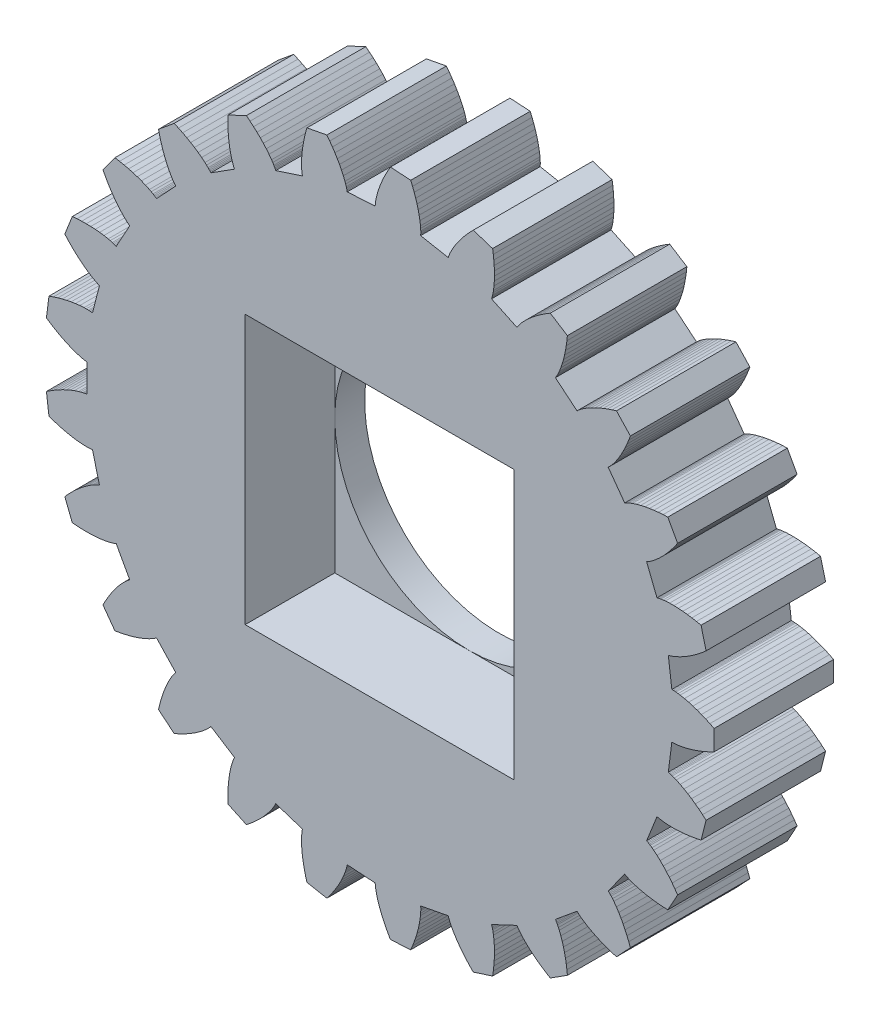
from build123d import *

# Parameters (mm, degrees)
MODEL_R             = 4.5
BOSS_EXTRUDE1_DEPTH = 4
SKETCH1_W           = 9
SKETCH1_H           = 9
CUT_EXTRUDE1_DEPTH  = 3


with BuildPart() as part:
    # Model → Boss-Extrude1 (new body)
    with BuildSketch(Plane.XY):
        Polygon((22.5153116, 13.49371), (22.5501244, 13.4944492), (22.5850516, 13.4935692), (22.6200756, 13.4916244), (22.6551524, 13.4887996), (22.7254732, 13.4809588), (22.7959612, 13.4705748), (22.9373156, 13.4433212), (23.0790396, 13.4084996), (23.2209836, 13.3669196), (23.3630332, 13.319118), (23.5050916, 13.2654556), (23.6470444, 13.2062052), (23.7888124, 13.1415956), (23.93029, 13.071794), (23.93029, 12.391466), (23.7888124, 12.3216644), (23.6470444, 12.257046), (23.5050916, 12.1978044), (23.3630332, 12.144142), (23.2209836, 12.0963316), (23.0790396, 12.0547516), (22.9373156, 12.01993), (22.7959612, 11.9926764), (22.7254732, 11.9822924), (22.6551524, 11.9744516), (22.6200756, 11.9716356), (22.5850516, 11.969682), (22.5501244, 11.9688108), (22.5153116, 11.96955), (22.397462, 11.036662), (22.4313596, 11.0287244), (22.4649756, 11.0191852), (22.4984068, 11.00859), (22.5316884, 10.9971324), (22.5978468, 10.9720524), (22.6635388, 10.9444644), (22.7936732, 10.8829084), (22.9222852, 10.8139428), (23.0494276, 10.7383684), (23.1751356, 10.6567396), (23.299374, 10.569426), (23.4221428, 10.4767444), (23.5433804, 10.378906), (23.6630604, 10.2761132), (23.4938716, 9.6171516), (23.3394756, 9.5847324), (23.1860916, 9.5574084), (23.0338604, 9.5353204), (22.8829228, 9.5186708), (22.733446, 9.5076972), (22.5856236, 9.5027252), (22.4396932, 9.5042388), (22.295998, 9.5129948), (22.2251404, 9.5204748), (22.1550836, 9.5303572), (22.1204028, 9.53635), (22.0860036, 9.5431788), (22.0519476, 9.5510108), (22.0184196, 9.5603828), (21.6722716, 8.6861204), (21.7031332, 8.6699988), (21.7333172, 8.6523988), (21.76307, 8.633822), (21.7924532, 8.6144532), (21.8502868, 8.5737004), (21.9070556, 8.530642), (22.0178036, 8.4386644), (22.1252164, 8.3398756), (22.2295756, 8.2350588), (22.331022, 8.1247332), (22.4296524, 8.0092684), (22.5255108, 7.8889636), (22.6186148, 7.7640476), (22.7089732, 7.634714), (22.3812172, 7.0385404), (22.2236092, 7.0455364), (22.068254, 7.0572052), (21.91531, 7.0736788), (21.7649708, 7.0950892), (21.6174652, 7.12163), (21.4730484, 7.153574), (21.3320812, 7.1913348), (21.195074, 7.2355548), (21.1283084, 7.2604148), (21.0629068, 7.2874132), (21.0308044, 7.3018452), (20.999186, 7.3170076), (20.9681484, 7.3330676), (20.9379996, 7.3504828), (20.3853068, 6.5897668), (20.4111876, 6.566482), (20.4360564, 6.5419212), (20.4602476, 6.5165332), (20.4838844, 6.4904676), (20.5297764, 6.4366116), (20.5740492, 6.3807932), (20.6584412, 6.264158), (20.737914, 6.1417588), (20.8129252, 6.014282), (20.8837564, 5.882194), (20.950566, 5.7458292), (21.0134948, 5.6054604), (21.0726132, 5.4613164), (21.1279652, 5.313582), (20.6622428, 4.8176404), (20.5113228, 4.8636116), (20.3637556, 4.9135604), (20.2197172, 4.9675484), (20.0794276, 5.0256724), (19.9431508, 5.0880556), (19.8112124, 5.154918), (19.6840612, 5.22655), (19.562366, 5.3034532), (19.5038724, 5.3441356), (19.4472444, 5.3865516), (19.4197444, 5.4085076), (19.392878, 5.431062), (19.3668124, 5.454338), (19.3419436, 5.4787052), (18.6174308, 4.8793372), (18.6367116, 4.8503412), (18.65469, 4.8203684), (18.671806, 4.789762), (18.6882268, 4.7586364), (18.7192732, 4.6950564), (18.748278, 4.6299804), (18.8010076, 4.4960268), (18.8475508, 4.3577084), (18.888506, 4.2155796), (18.9242516, 4.0700276), (18.9550604, 3.921334), (18.9810996, 3.7697276), (19.00251, 3.6154108), (19.0193796, 3.4585508), (18.4449596, 3.0940108), (18.310214, 3.1760708), (18.1797012, 3.2611404), (18.0536148, 3.3492548), (17.9321836, 3.4404404), (17.8157068, 3.5347676), (17.7045452, 3.6323332), (17.5992092, 3.7333396), (17.5004468, 3.838086), (17.4539124, 3.8920388), (17.4096132, 3.947206), (17.3884316, 3.9753132), (17.3680332, 4.003834), (17.3485676, 4.0328564), (17.3305364, 4.0626444), (16.4797348, 3.6622884), (16.4911924, 3.6294116), (16.501154, 3.59591), (16.5101212, 3.5620124), (16.5182788, 3.5277716), (16.5325524, 3.4584716), (16.5444588, 3.38823), (16.5622172, 3.2453708), (16.5729004, 3.0998188), (16.5772212, 2.9519788), (16.575646, 2.802106), (16.5685092, 2.6504204), (16.5560308, 2.497098), (16.5383868, 2.342306), (16.515718, 2.1861764), (15.8686892, 1.9759444), (15.7585836, 2.0889364), (15.6533268, 2.203794), (15.5531124, 2.3204996), (15.458178, 2.439018), (15.368814, 2.5593404), (15.2854076, 2.6814932), (15.2084956, 2.8055204), (15.1388964, 2.9315364), (15.107234, 2.9953628), (15.0780444, 3.059814), (15.0645276, 3.0923036), (15.0518556, 3.1250044), (15.040222, 3.1579604), (15.0301724, 3.1912948), (14.1065244, 3.0151012), (14.1094548, 2.9804116), (14.110766, 2.9454844), (14.1110212, 2.9104164), (14.110414, 2.8752252), (14.1069996, 2.8045612), (14.1010596, 2.733554), (14.082738, 2.5907652), (14.0568836, 2.4471404), (14.024306, 2.3028644), (13.9855068, 2.1580868), (13.9408732, 2.0129484), (13.8906516, 1.867546), (13.8350708, 1.7220028), (13.7742892, 1.5764156), (13.0953076, 1.5337004), (13.0167588, 1.6705228), (12.9433668, 1.8079524), (12.8753252, 1.94591), (12.8128452, 2.0843076), (12.7562172, 2.2230836), (12.7058108, 2.3621324), (12.662154, 2.5013924), (12.6260828, 2.640758), (12.61129, 2.710454), (12.5990492, 2.7801412), (12.5940332, 2.8149716), (12.5898884, 2.849802), (12.5868172, 2.8846148), (12.585374, 2.9194012), (11.6469332, 2.9784404), (11.641134, 2.9441116), (11.6337244, 2.9099588), (11.62525, 2.8759292), (11.6159044, 2.8419964), (11.5950308, 2.7743948), (11.5716228, 2.7071012), (11.5183564, 2.57335), (11.4576012, 2.4406636), (11.390158, 2.3090244), (11.3165812, 2.17845), (11.2372492, 2.0489668), (11.1524524, 1.9206276), (11.0624196, 1.7934764), (10.9673444, 1.6675836), (10.2990636, 1.7950604), (10.2570084, 1.9471156), (10.22011, 2.0984756), (10.188518, 2.249026), (10.1624172, 2.3986172), (10.1420716, 2.5471084), (10.1278332, 2.6943324), (10.120186, 2.8400692), (10.1199044, 2.9840284), (10.122914, 3.0552116), (10.1283788, 3.1257524), (10.1321804, 3.1607412), (10.1368356, 3.1955012), (10.1425204, 3.2299884), (10.1497628, 3.2640444), (9.2554892, 3.5546116), (9.2413388, 3.5227996), (9.225666, 3.4915596), (9.2089988, 3.4607068), (9.1915132, 3.430162), (9.154474, 3.369882), (9.1150676, 3.3105172), (9.030218, 3.1942252), (8.9383724, 3.0808108), (8.840314, 2.9700804), (8.7365708, 2.861902), (8.62753, 2.756214), (8.513482, 2.6529988), (8.3946556, 2.55223), (8.2712532, 2.453934), (7.6556756, 2.7436036), (7.6527628, 2.9013436), (7.6546548, 3.05713), (7.6614924, 3.2108044), (7.6734164, 3.362182), (7.6906468, 3.5110692), (7.7134652, 3.6572108), (7.742294, 3.8002724), (7.7778196, 3.9397788), (7.798438, 4.0079788), (7.8212828, 4.0749468), (7.8336732, 4.1078852), (7.8468204, 4.1404012), (7.8608916, 4.1723804), (7.8763884, 4.2035676), (7.08247, 4.7074028), (7.0608484, 4.6801052), (7.0379068, 4.6537492), (7.0140852, 4.6280092), (6.9895508, 4.6027796), (6.938678, 4.5535964), (6.8857548, 4.5059004), (6.774646, 4.4143628), (6.6574828, 4.3273572), (6.5349692, 4.2444876), (6.4075804, 4.1655076), (6.275686, 4.0902588), (6.13955, 4.0186444), (5.9994012, 3.9506028), (5.8554332, 3.8860812), (5.331226, 4.3197364), (5.3676316, 4.4732436), (5.4082084, 4.623662), (5.4530444, 4.7708068), (5.5022452, 4.9144668), (5.5559604, 5.0543956), (5.6144012, 5.1902676), (5.6779108, 5.3216604), (5.7470084, 5.4479492), (5.783942, 5.5088804), (5.8227236, 5.5680604), (5.8429108, 5.5968892), (5.8637316, 5.6251108), (5.885318, 5.6525932), (5.9080836, 5.6789404), (5.2643988, 6.36439), (5.2366788, 6.3433316), (5.207894, 6.3235052), (5.1784228, 6.3044972), (5.1483884, 6.286158), (5.0868852, 6.2511692), (5.023754, 6.2181428), (4.8933732, 6.157106), (4.758258, 6.101974), (4.6189804, 6.0521748), (4.475954, 6.0073564), (4.3294868, 5.9672724), (4.1798164, 5.9317644), (4.027154, 5.9007092), (3.871658, 5.8740188), (3.4717684, 6.4244148), (3.5452044, 6.5640532), (3.6219228, 6.6996436), (3.7019412, 6.8310188), (3.7853212, 6.9579324), (3.872142, 7.0801028), (3.9625444, 7.197178), (4.0567308, 7.3086476), (4.1550708, 7.4137812), (4.2059964, 7.4636156), (4.2582684, 7.511294), (4.284994, 7.5341916), (4.3121772, 7.55635), (4.3399236, 7.577602), (4.3685236, 7.5974636), (3.9155348, 8.4214516), (3.8834412, 8.4079436), (3.8506348, 8.3959052), (3.817362, 8.384826), (3.783702, 8.37453), (3.7154316, 8.3559356), (3.6460788, 8.3396468), (3.50461, 8.3129476), (3.360026, 8.2931564), (3.2127404, 8.2795516), (3.0630612, 8.2717108), (2.9112348, 8.2693172), (2.7574372, 8.272142), (2.6018356, 8.2800268), (2.4445972, 8.2928484), (2.1941492, 8.9254012), (2.2999956, 9.0423884), (2.4080244, 9.15465), (2.5182004, 9.2619924), (2.6305236, 9.364178), (2.7450028, 9.4609252), (2.8616732, 9.5518292), (2.9806316, 9.6363796), (3.1020276, 9.713758), (3.163742, 9.7493628), (3.2262308, 9.7825388), (3.257814, 9.7980708), (3.2896524, 9.8127756), (3.3218076, 9.8264508), (3.3544468, 9.8385772), (3.1206044, 10.7493332), (3.0861612, 10.744238), (3.0513924, 10.7407356), (3.0164124, 10.7382716), (2.9812564, 10.7366788), (2.9105044, 10.7356404), (2.8392772, 10.73711), (2.6956172, 10.7464292), (2.550646, 10.7632196), (2.40461, 10.7866804), (2.2576852, 10.8163012), (2.1100212, 10.8517388), (1.9617588, 10.8927292), (1.8130124, 10.9390612), (1.6638964, 10.9905764), (1.5786332, 11.6655452), (1.7102548, 11.7525332), (1.8428004, 11.8343996), (1.9762172, 11.9109684), (2.1104172, 11.9820196), (2.2453652, 12.0472452), (2.3809732, 12.1062932), (2.5172148, 12.1586004), (2.654046, 12.2033572), (2.7226772, 12.2224884), (2.791458, 12.2390852), (2.8259012, 12.2462748), (2.8603972, 12.252602), (2.894946, 12.2578468), (2.9295828, 12.2614812), (2.9295828, 13.2017788), (2.894946, 13.2054044), (2.8603972, 13.210658), (2.8259012, 13.2169764), (2.791458, 13.224166), (2.7226772, 13.2407628), (2.654046, 13.2599028), (2.5172148, 13.3046596), (2.3809732, 13.3569668), (2.2453652, 13.416006), (2.1104172, 13.4812404), (1.9762172, 13.5522828), (1.8428004, 13.6288604), (1.7102548, 13.7107268), (1.5786332, 13.797706), (1.6638964, 14.4726748), (1.8130124, 14.5241988), (1.9617588, 14.5705308), (2.1100212, 14.6115124), (2.2576852, 14.64695), (2.40461, 14.6765796), (2.550646, 14.7000404), (2.6956172, 14.716822), (2.8392772, 14.7261412), (2.9105044, 14.7276108), (2.9812564, 14.7265812), (3.0164124, 14.7249796), (3.0513924, 14.7225244), (3.0861612, 14.7190132), (3.1206044, 14.713918), (3.3544468, 15.624674), (3.3218076, 15.6368004), (3.2896524, 15.6504844), (3.257814, 15.6651804), (3.2262308, 15.6807124), (3.163742, 15.7138972), (3.1020276, 15.7494932), (2.9806316, 15.8268716), (2.8616732, 15.911422), (2.7450028, 16.0023348), (2.6305236, 16.0990732), (2.5182004, 16.2012676), (2.4080244, 16.30861), (2.2999956, 16.4208716), (2.1941492, 16.5378588), (2.4445972, 17.1704116), (2.6018356, 17.1832244), (2.7574372, 17.1911092), (2.9112348, 17.1939428), (3.0630612, 17.1915404), (3.2127404, 17.1836996), (3.360026, 17.1701036), (3.50461, 17.1503124), (3.6460788, 17.1236132), (3.7154316, 17.1073156), (3.783702, 17.0887212), (3.817362, 17.078434), (3.8506348, 17.0673548), (3.8834412, 17.0553076), (3.9155348, 17.0418084), (4.3685236, 17.8657964), (4.3399236, 17.885658), (4.3121772, 17.9069012), (4.284994, 17.9290596), (4.2582684, 17.9519572), (4.2059964, 17.9996356), (4.1550708, 18.04947), (4.0567308, 18.1546036), (3.9625444, 18.266082), (3.872142, 18.3831484), (3.7853212, 18.5053188), (3.7019412, 18.6322324), (3.6219228, 18.7636076), (3.5452044, 18.8992068), (3.4717684, 19.0388364), (3.871658, 19.5892412), (4.027154, 19.5625508), (4.1798164, 19.5314868), (4.3294868, 19.4959788), (4.475954, 19.4559036), (4.6189804, 19.4110764), (4.758258, 19.361286), (4.8933732, 19.306154), (5.023754, 19.2451172), (5.0868852, 19.212082), (5.1483884, 19.1770932), (5.1784228, 19.158754), (5.207894, 19.1397548), (5.2366788, 19.1199284), (5.2643988, 19.09887), (5.9080836, 19.7843108), (5.885318, 19.8106668), (5.8637316, 19.8381404), (5.8429108, 19.866362), (5.8227236, 19.8951908), (5.783942, 19.9543708), (5.7470084, 20.015302), (5.6779108, 20.1415908), (5.6144012, 20.2729836), (5.5559604, 20.4088644), (5.5022452, 20.5487844), (5.4530444, 20.6924532), (5.4082084, 20.839598), (5.3676316, 20.9900076), (5.331226, 21.1435236), (5.8554332, 21.5771788), (5.9994012, 21.5126572), (6.13955, 21.4446068), (6.275686, 21.3729924), (6.4075804, 21.2977436), (6.5349692, 21.2187636), (6.6574828, 21.135894), (6.774646, 21.0488972), (6.8857548, 20.9573508), (6.938678, 20.9096548), (6.9895508, 20.8604804), (7.0140852, 20.835242), (7.0379068, 20.809502), (7.0608484, 20.783146), (7.08247, 20.7558572), (7.8763884, 21.2596924), (7.8608916, 21.2908708), (7.8468204, 21.3228588), (7.8336732, 21.355366), (7.8212828, 21.3883132), (7.798438, 21.4552724), (7.7778196, 21.5234724), (7.742294, 21.6629876), (7.7134652, 21.8060404), (7.6906468, 21.952182), (7.6734164, 22.1010692), (7.6614924, 22.2524556), (7.6546548, 22.40613), (7.6527628, 22.5619076), (7.6556756, 22.7196476), (8.2712532, 23.0093172), (8.3946556, 22.9110212), (8.513482, 22.8102612), (8.62753, 22.7070372), (8.7365708, 22.6013492), (8.840314, 22.4931708), (8.9383724, 22.3824404), (9.030218, 22.2690348), (9.1150676, 22.152734), (9.154474, 22.093378), (9.1915132, 22.0330892), (9.2089988, 22.0025532), (9.225666, 21.9716916), (9.2413388, 21.9404604), (9.2554892, 21.9086484), (10.1497628, 22.1992156), (10.1425204, 22.2332716), (10.1368356, 22.26775), (10.1321804, 22.30251), (10.1283788, 22.3374988), (10.122914, 22.4080396), (10.1199044, 22.4792228), (10.120186, 22.623182), (10.1278332, 22.7689188), (10.1420716, 22.9161428), (10.1624172, 23.064634), (10.188518, 23.214234), (10.22011, 23.3647756), (10.2570084, 23.5161356), (10.2990636, 23.6681908), (10.9673444, 23.7956764), (11.0624196, 23.6697748), (11.1524524, 23.5426324), (11.2372492, 23.4142932), (11.3165812, 23.28481), (11.390158, 23.1542268), (11.4576012, 23.0225876), (11.5183564, 22.8899012), (11.5716228, 22.7561588), (11.5950308, 22.6888652), (11.6159044, 22.6212636), (11.62525, 22.5873308), (11.6337244, 22.5533012), (11.641134, 22.5191484), (11.6469332, 22.4848108), (12.585374, 22.5438588), (12.5868172, 22.5786452), (12.5898884, 22.613458), (12.5940332, 22.6482796), (12.5990492, 22.68311), (12.61129, 22.7527972), (12.6260828, 22.8224932), (12.662154, 22.9618676), (12.7058108, 23.1011188), (12.7562172, 23.2401764), (12.8128452, 23.3789436), (12.8753252, 23.51735), (12.9433668, 23.6553076), (13.0167588, 23.7927372), (13.0953076, 23.9295596), (13.7742892, 23.8868356), (13.8350708, 23.7412484), (13.8906516, 23.5957052), (13.9408732, 23.4503116), (13.9855068, 23.3051644), (14.024306, 23.1603956), (14.0568836, 23.0161196), (14.082738, 22.872486), (14.1010596, 22.7296972), (14.1069996, 22.6586988), (14.110414, 22.588026), (14.1110212, 22.5528348), (14.110766, 22.5177668), (14.1094548, 22.4828484), (14.1065244, 22.44815), (15.0301724, 22.2719564), (15.040222, 22.3052908), (15.0518556, 22.3382468), (15.0645276, 22.3709476), (15.0780444, 22.4034372), (15.107234, 22.4678884), (15.1388964, 22.5317236), (15.2084956, 22.6577396), (15.2854076, 22.7817668), (15.368814, 22.9039108), (15.458178, 23.024242), (15.5531124, 23.1427604), (15.6533268, 23.2594572), (15.7585836, 23.3743236), (15.8686892, 23.4873068), (16.515718, 23.2770748), (16.5383868, 23.1209452), (16.5560308, 22.9661532), (16.5685092, 22.8128396), (16.575646, 22.661154), (16.5772212, 22.5112812), (16.5729004, 22.3634324), (16.5622172, 22.2178892), (16.5444588, 22.07503), (16.5325524, 22.0047796), (16.5182788, 21.9354796), (16.5101212, 21.9012476), (16.501154, 21.8673412), (16.4911924, 21.8338484), (16.4797348, 21.8009628), (17.3305364, 21.4006068), (17.3485676, 21.4303948), (17.3680332, 21.4594172), (17.3884316, 21.4879468), (17.4096132, 21.516054), (17.4539124, 21.5712212), (17.5004468, 21.625174), (17.5992092, 21.7299204), (17.7045452, 21.830918), (17.8157068, 21.9284924), (17.9321836, 22.0228108), (18.0536148, 22.1139964), (18.1797012, 22.2021108), (18.310214, 22.2871892), (18.4449596, 22.3692404), (19.0193796, 22.0047092), (19.00251, 21.8478404), (18.9810996, 21.6935236), (18.9550604, 21.541926), (18.9242516, 21.3932324), (18.888506, 21.2476716), (18.8475508, 21.1055428), (18.8010076, 20.9672332), (18.748278, 20.8332708), (18.7192732, 20.7681948), (18.6882268, 20.7046236), (18.671806, 20.6734892), (18.65469, 20.6428828), (18.6367116, 20.6129188), (18.6174308, 20.5839228), (19.3419436, 19.9845548), (19.3668124, 20.008922), (19.392878, 20.032198), (19.4197444, 20.0547436), (19.4472444, 20.0767084), (19.5038724, 20.1191244), (19.562366, 20.1598068), (19.6840612, 20.2367012), (19.8112124, 20.3083332), (19.9431508, 20.3751956), (20.0794276, 20.4375876), (20.2197172, 20.4957116), (20.3637556, 20.5496996), (20.5113228, 20.5996396), (20.6622428, 20.6456108), (21.1279652, 20.1496692), (21.0726132, 20.0019348), (21.0134948, 19.8577908), (20.950566, 19.7174308), (20.8837564, 19.581066), (20.8129252, 19.448978), (20.737914, 19.3215012), (20.6584412, 19.199102), (20.5740492, 19.0824668), (20.5297764, 19.0266484), (20.4838844, 18.9727924), (20.4602476, 18.946718), (20.4360564, 18.92133), (20.4111876, 18.896778), (20.3853068, 18.8734844), (20.9379996, 18.1127684), (20.9681484, 18.1301836), (20.999186, 18.1462436), (21.0308044, 18.161406), (21.0629068, 18.175838), (21.1283084, 18.2028452), (21.195074, 18.2277052), (21.3320812, 18.2719164), (21.4730484, 18.3096772), (21.6174652, 18.34163), (21.7649708, 18.3681708), (21.91531, 18.3895724), (22.068254, 18.406046), (22.2236092, 18.4177236), (22.3812172, 18.4247108), (22.7089732, 17.8285372), (22.6186148, 17.6992124), (22.5255108, 17.5742964), (22.4296524, 17.4539916), (22.331022, 17.3385268), (22.2295756, 17.2282012), (22.1252164, 17.1233844), (22.0178036, 17.0245956), (21.9070556, 16.9326092), (21.8502868, 16.8895508), (21.7924532, 16.8488068), (21.76307, 16.8294292), (21.7333172, 16.8108612), (21.7031332, 16.7932612), (21.6722716, 16.7771308), (22.0184196, 15.9028684), (22.0519476, 15.9122404), (22.0860036, 15.9200812), (22.1204028, 15.9269012), (22.1550836, 15.932894), (22.2251404, 15.9427852), (22.295998, 15.9502564), (22.4396932, 15.9590124), (22.5856236, 15.9605348), (22.733446, 15.9555628), (22.8829228, 15.9445804), (23.0338604, 15.9279308), (23.1860916, 15.9058516), (23.3394756, 15.8785276), (23.4938716, 15.8460996), (23.6630604, 15.1871468), (23.5433804, 15.084354), (23.4221428, 14.9865156), (23.299374, 14.8938252), (23.1751356, 14.8065204), (23.0494276, 14.7248828), (22.9222852, 14.6493172), (22.7936732, 14.5803428), (22.6635388, 14.5187868), (22.5978468, 14.4912076), (22.5316884, 14.4661188), (22.4984068, 14.4546612), (22.4649756, 14.4440748), (22.4313596, 14.4345356), (22.397462, 14.4265892), align=None)
        with Locations((12.73163, 12.73163)):
            Circle(MODEL_R, mode=Mode.SUBTRACT)
    extrude(amount=BOSS_EXTRUDE1_DEPTH)

    # Sketch1 → Cut-Extrude1 (cut)
    with BuildSketch(Plane.XY.offset(4)):
        with Locations((12.73163, 12.73163)):
            Rectangle(SKETCH1_W, SKETCH1_H)
    extrude(amount=-CUT_EXTRUDE1_DEPTH, mode=Mode.SUBTRACT)


solid = part.part
